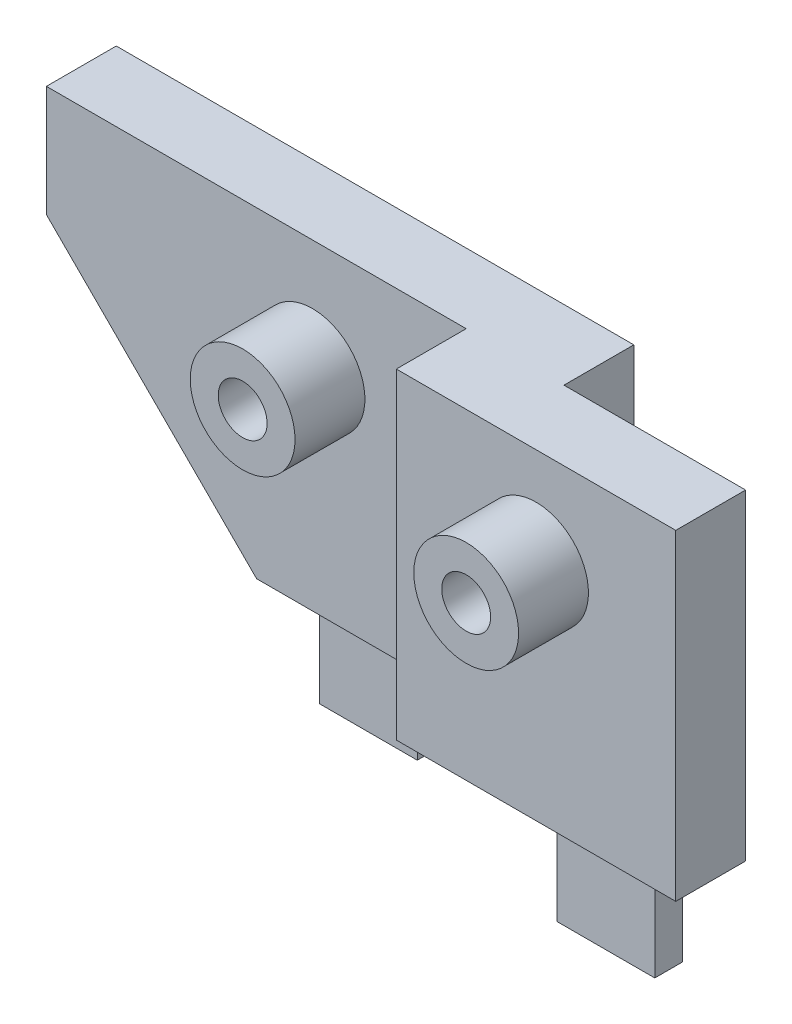
from build123d import *

# Parameters (mm, degrees)
BOSS_EXTRUDE1_DEPTH = 23
SKETCH2_R           = 1.75
CUT_EXTRUDE1_DEPTH  = 10
SKETCH3_R           = 1.5
CUT_EXTRUDE2_DEPTH  = 10
SKETCH4_W           = 7
SKETCH4_H           = 2
BOSS_EXTRUDE2_DEPTH = 7
BOSS_EXTRUDE3_START = 5
SKETCH6_R           = 3.75
SKETCH6_R_2         = 1.75
BOSS_EXTRUDE3_DEPTH = 5
BOSS_EXTRUDE4_START = 5
SKETCH7_R           = 3.75
SKETCH7_R_2         = 1.75
BOSS_EXTRUDE4_DEPTH = 5
BOSS_EXTRUDE5_DEPTH = 5


with BuildPart() as part:
    # Sketch1 → Boss-Extrude1 (new body)
    with BuildSketch(Plane(origin=(0, 0, 0), x_dir=(1, 0, 0), z_dir=(0, 1, 0))):
        Polygon((18, 0), (22, 0), (22, -5), (35, -5), (35, -10), (15, -10), (15, -5), (0, -5), (0, 0), align=None)
    extrude(amount=BOSS_EXTRUDE1_DEPTH)

    # Sketch2 → Cut-Extrude1 (cut)
    with BuildSketch(Plane.XY.offset(10)):
        with Locations((4, 15)):
            Circle(SKETCH2_R)
        with Locations((25, 16)):
            Circle(SKETCH2_R)
    extrude(amount=-CUT_EXTRUDE1_DEPTH, mode=Mode.SUBTRACT)

    # Sketch3 → Cut-Extrude2 (cut)
    with BuildSketch(Plane.XZ):
        with Locations((18.5, 5)):
            Circle(SKETCH3_R)
    extrude(amount=-CUT_EXTRUDE2_DEPTH, mode=Mode.SUBTRACT)

    # Sketch4 → Boss-Extrude2 (add)
    with BuildSketch(Plane.XZ):
        with Locations((6.5, 2.5)):
            Rectangle(SKETCH4_W, SKETCH4_H)
        with Locations((28.5, 7.5)):
            Rectangle(SKETCH4_W, SKETCH4_H)
    extrude(amount=BOSS_EXTRUDE2_DEPTH)

    # Sketch6 → Boss-Extrude3 (add)
    with BuildSketch(Plane.XY.offset(5).offset(BOSS_EXTRUDE3_START)):
        with Locations((4, 15)):
            Circle(SKETCH6_R)
        with Locations((4, 15)):
            Circle(SKETCH6_R_2, mode=Mode.SUBTRACT)
    extrude(amount=-BOSS_EXTRUDE3_DEPTH)

    # Sketch7 → Boss-Extrude4 (add)
    with BuildSketch(Plane.XY.offset(10).offset(BOSS_EXTRUDE4_START)):
        with Locations((25, 16)):
            Circle(SKETCH7_R)
        with Locations((25, 16)):
            Circle(SKETCH7_R_2, mode=Mode.SUBTRACT)
    extrude(amount=-BOSS_EXTRUDE4_DEPTH)

    # Sketch10 → Boss-Extrude5 (add)
    with BuildSketch(Plane.XY.offset(5)):
        Polygon((0, 23), (-15.047232304, 23), (-15.047232304, 15.047232304), (0, 0), align=None)
    extrude(amount=-BOSS_EXTRUDE5_DEPTH)


solid = part.part
